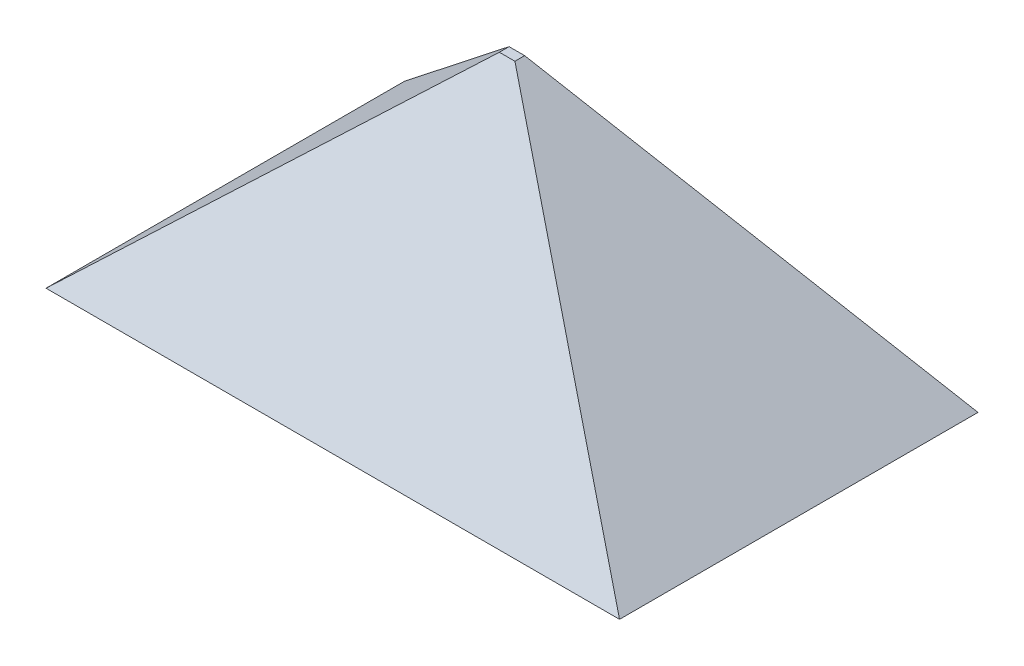
from build123d import *


with BuildPart() as part:
    # Sketch2 → FOV section 0
    with BuildSketch(Plane(origin=(0, 90.932, 0), x_dir=(1, 0, 0), z_dir=(0, 1, 0))):
        with BuildLine():
            Line((-2.755394972, -1.722121857), (2.755394972, -1.722121857))
            Line((2.755394972, -1.722121857), (2.755394972, 1.722121857))
            Line((2.755394972, 1.722121857), (-2.755394972, 1.722121857))
            Line((-2.755394972, 1.722121857), (-2.755394972, -1.722121857))
        make_face()
    # Sketch1 → FOV section 1
    with BuildSketch(Plane(origin=(0, 0, 0), x_dir=(1, 0, 0), z_dir=(0, 1, 0))):
        with BuildLine():
            Line((-101.6, -63.5), (101.6, -63.5))
            Line((101.6, -63.5), (101.6, 63.5))
            Line((101.6, 63.5), (-101.6, 63.5))
            Line((-101.6, 63.5), (-101.6, -63.5))
        make_face()
    loft()


solid = part.part
